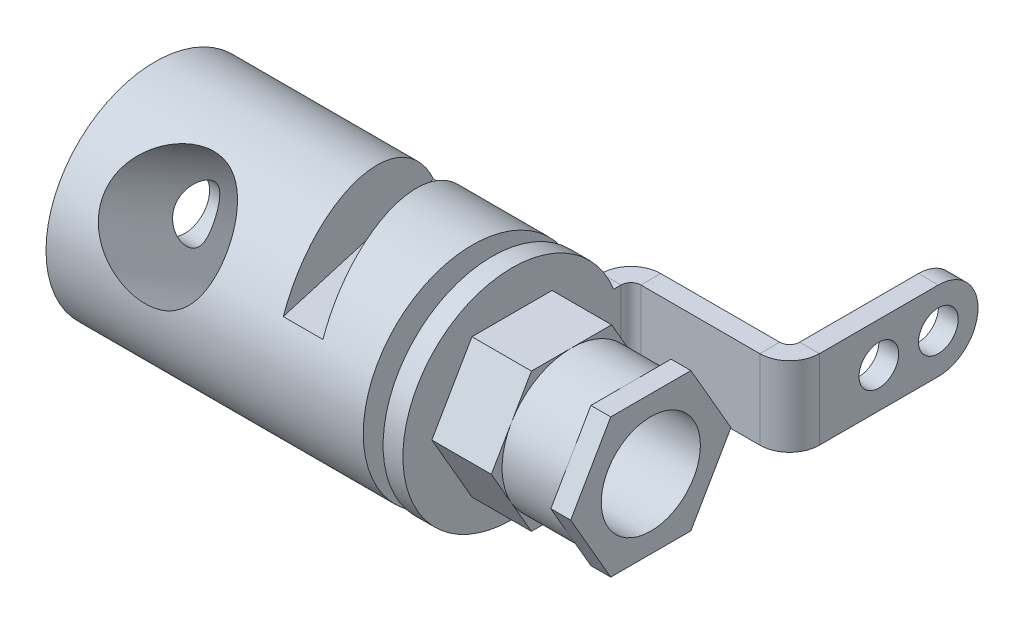
from build123d import *

# Parameters (mm, degrees)
SKETCH1_R           = 5.5
BOSS_EXTRUDE1_DEPTH = 16
SKETCH2_R           = 3.5
BOSS_EXTRUDE2_DEPTH = 1
SKETCH3_R           = 5.5
BOSS_EXTRUDE3_DEPTH = 1
SKETCH5_W           = 1
SKETCH5_H           = 4
FILLET1_R           = 2
BOSS_EXTRUDE4_DEPTH = 3
SKETCH8_R           = 3.5
BOSS_EXTRUDE5_DEPTH = 3
BOSS_EXTRUDE7_DEPTH = 1
SKETCH17_R          = 2.5
CUT_EXTRUDE7_DEPTH  = 6
SKETCH18_R          = 1.25
CUT_EXTRUDE8_DEPTH  = 26.129663746
SKETCH19_R          = 4.5
CUT_EXTRUDE9_DEPTH  = 1.5
SKETCH21_R          = 3
CUT_EXTRUDE10_DEPTH = 30.314547048
CUT_EXTRUDE12_DEPTH = 3
SKETCH24_R          = 1
CUT_EXTRUDE13_DEPTH = 3


with BuildPart() as part:
    # Sketch1 → Boss-Extrude1 (new body)
    with BuildSketch(Plane(origin=(0, 0, 0), x_dir=(0, 0, -1), z_dir=(1, 0, 0))):
        Circle(SKETCH1_R)
    extrude(amount=BOSS_EXTRUDE1_DEPTH)

    # Sketch2 → Boss-Extrude2 (add)
    with BuildSketch(Plane(origin=(16, 0, 0), x_dir=(0, 0, -1), z_dir=(1, 0, 0))):
        Circle(SKETCH2_R)
    extrude(amount=BOSS_EXTRUDE2_DEPTH)

    # Sketch3 → Boss-Extrude3 (add)
    with BuildSketch(Plane(origin=(17, 0, 0), x_dir=(0, 0, -1), z_dir=(1, 0, 0))):
        Circle(SKETCH3_R)
    extrude(amount=BOSS_EXTRUDE3_DEPTH)

    # Sweep1: sweep along a path in Sketch4
    with BuildLine(Plane(origin=(0, 0, 0), x_dir=(1, 0, 0), z_dir=(0, 1, 0))) as sweep1_path:
        Line((25.5, 15.5), (25.5, 7.5))
        ThreePointArc((25.5, 7.5), (25.207106781, 6.792893219), (24.5, 6.5))
        Line((24.5, 6.5), (18.5, 6.5))
        ThreePointArc((18.5, 6.5), (17.792893219, 6.207106781), (17.5, 5.5))
        Line((17.5, 5.5), (17.5, 4.331461844))
    # Sketch5 → Sweep1 (sweep)
    with BuildSketch(Plane.XY.offset(-15.5)):
        with Locations((25.5, 0)):
            Rectangle(SKETCH5_W, SKETCH5_H)
    sweep(path=sweep1_path.line)

    # Fillet1
    fillet1_edges = [part.edges().sort_by_distance(p)[0] for p in [
        (25.5, -2, -15.5),
        (25.5, 2, -15.5),
    ]]
    fillet(fillet1_edges, radius=FILLET1_R - 0.0001)  # a hair under: the kernel refuses the full size

    # Sketch7 → Boss-Extrude4 (add)
    with BuildSketch(Plane(origin=(18, 0, 0), x_dir=(0, 0, -1), z_dir=(1, 0, 0))):
        Polygon((-2.020725942, -3.5), (2.020725942, -3.5), (4.041451884, 0), (2.020725942, 3.5), (-2.020725942, 3.5), (-4.041451884, 0), align=None)
    extrude(amount=BOSS_EXTRUDE4_DEPTH)

    # Sketch8 → Boss-Extrude5 (add)
    with BuildSketch(Plane(origin=(21, 0, 0), x_dir=(0, 0, -1), z_dir=(1, 0, 0))):
        Circle(SKETCH8_R)
    extrude(amount=BOSS_EXTRUDE5_DEPTH)

    # Sketch9 → Boss-Extrude7 (add)
    with BuildSketch(Plane(origin=(24, 0, 0), x_dir=(0, 0, -1), z_dir=(1, 0, 0))):
        Polygon((-2.020725942, -3.5), (2.020725942, -3.5), (4.041451884, 0), (2.020725942, 3.5), (-2.020725942, 3.5), (-4.041451884, 0), align=None)
    extrude(amount=BOSS_EXTRUDE7_DEPTH)

    # Sketch17 → Cut-Extrude7 (cut)
    with BuildSketch(Plane(origin=(25, 0, 0), x_dir=(0, 0, -1), z_dir=(1, 0, 0))):
        Circle(SKETCH17_R)
    extrude(amount=-CUT_EXTRUDE7_DEPTH, mode=Mode.SUBTRACT)

    # Sketch18 → Cut-Extrude8 (cut, through all)
    with BuildSketch(Plane(origin=(19, 0, 0), x_dir=(0, 0, -1), z_dir=(1, 0, 0))):
        Circle(SKETCH18_R)
    extrude(amount=-CUT_EXTRUDE8_DEPTH, mode=Mode.SUBTRACT)

    # Sketch19 → Cut-Extrude9 (cut)
    with BuildSketch(Plane.ZY):
        Circle(SKETCH19_R)
    extrude(amount=-CUT_EXTRUDE9_DEPTH, mode=Mode.SUBTRACT)

    # Sketch21 → Cut-Extrude10 (cut, through all)
    with BuildSketch(Plane(origin=(0, -2.75, -4.763139721), x_dir=(-1, 0, 0), z_dir=(0, -0.5000000000000002, -0.8660254037844385))):
        with Locations(Location((-5.001832393, 0.406031974, 0), (0, 0, 90))):
            Circle(SKETCH21_R)
    extrude(amount=-CUT_EXTRUDE10_DEPTH, mode=Mode.SUBTRACT)

    # Sketch23 → Cut-Extrude12 (cut)
    with BuildSketch(Plane(origin=(0, 5.5, 0), x_dir=(1, 0, 0), z_dir=(0, 1, 0))):
        Polygon((11, 5.5), (13.5, -5.5), (11.5, -5.5), (9, 5.5), align=None)
    extrude(amount=-CUT_EXTRUDE12_DEPTH, mode=Mode.SUBTRACT)

    # Sketch24 → Cut-Extrude13 (cut)
    with BuildSketch(Plane.ZY.offset(-25)):
        with Locations((-13.5, 0)):
            Circle(SKETCH24_R)
        with Locations((-10.5, 0)):
            Circle(SKETCH24_R)
    extrude(amount=-CUT_EXTRUDE13_DEPTH, mode=Mode.SUBTRACT)


solid = part.part
